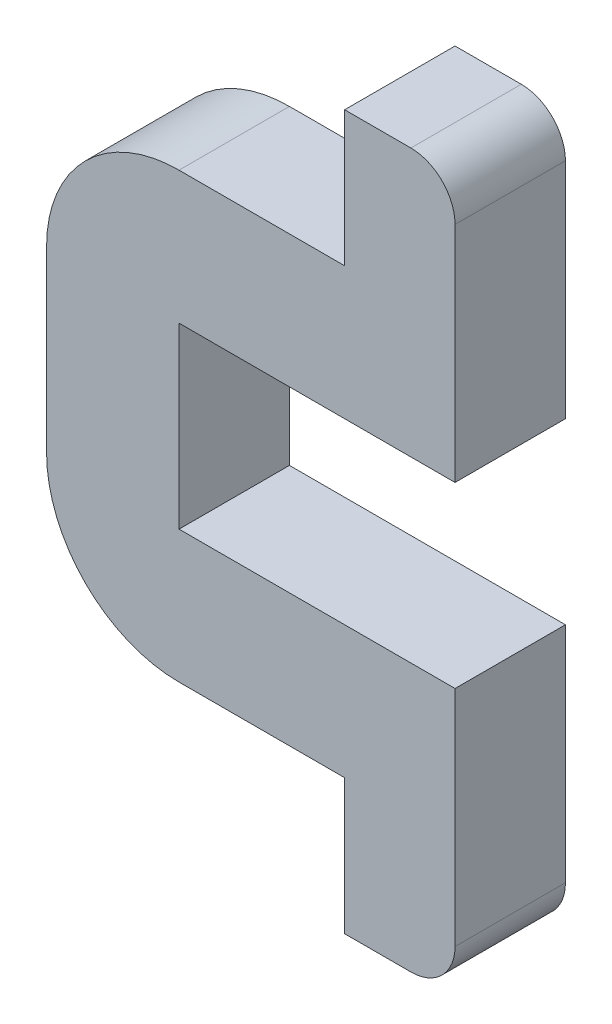
from build123d import *

# Parameters (mm, degrees)
BOSS_EXTRUDE1_DEPTH = 0.125
FILLET1_R           = 0.3
FILLET2_R           = 0.1


with BuildPart() as part:
    # frame_outline → Boss-Extrude1 (new, symmetric)
    with BuildSketch(Plane.XY):
        Polygon((0, 0), (-0.625, 0), (-0.625, 0.404), (0, 0.404), (0, 1.01), (-0.25, 1.01), (-0.25, 0.704), (-0.925, 0.704), (-0.925, -0.3), (-0.25, -0.3), (-0.25, -0.606), (0, -0.606), align=None)
    extrude(amount=BOSS_EXTRUDE1_DEPTH, both=True)

    # Fillet1
    fillet1_edges = [part.edges().sort_by_distance(p)[0] for p in [
        (-0.925, -0.3, 0),
        (-0.925, 0.704, 0),
    ]]
    fillet(fillet1_edges, radius=FILLET1_R)

    # Fillet2
    fillet2_edges = [part.edges().sort_by_distance(p)[0] for p in [
        (0, 1.01, 0),
        (0, -0.606, 0),
    ]]
    fillet(fillet2_edges, radius=FILLET2_R)


solid = part.part
